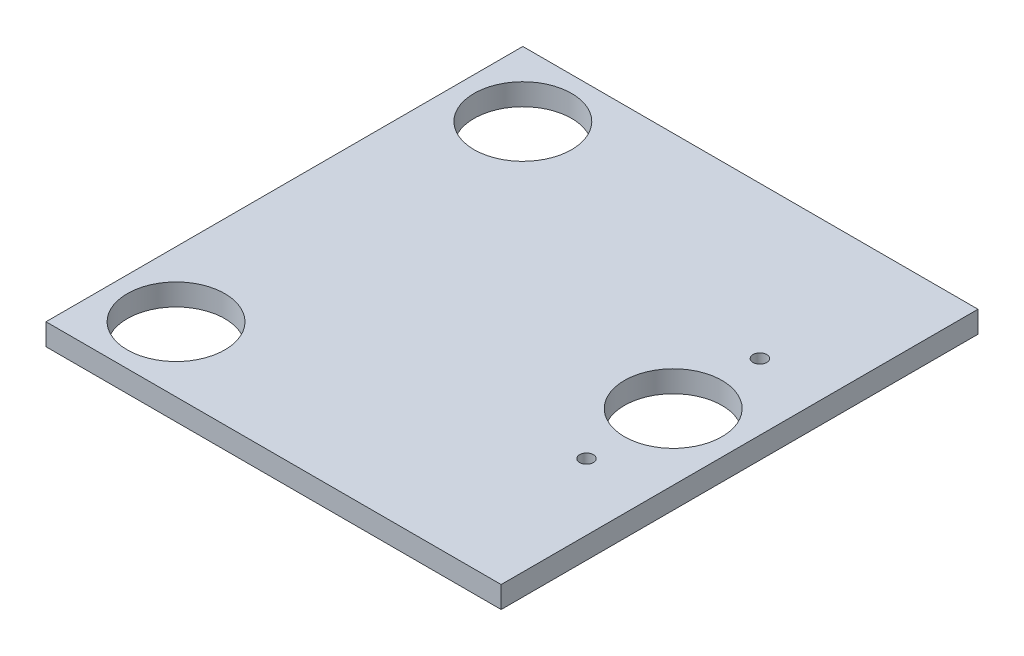
from build123d import *

# Parameters (mm, degrees)
SKETCH1_W           = 133.35
SKETCH1_H           = 139.7
SKETCH1_R           = 14.2875
SKETCH1_R_2         = 2.0193
BOSS_EXTRUDE1_DEPTH = 6.35


with BuildPart() as part:
    # Sketch1 → Boss-Extrude1 (new body)
    with BuildSketch(Plane(origin=(0, 0, 0), x_dir=(1, 0, 0), z_dir=(0, 1, 0))):
        with Locations((66.675, 0)):
            Rectangle(SKETCH1_W, SKETCH1_H)
        with Locations((19.05, 50.8)):
            Circle(SKETCH1_R, mode=Mode.SUBTRACT)
        with Locations((19.05, -50.8)):
            Circle(SKETCH1_R, mode=Mode.SUBTRACT)
        with Locations((113.900712, 0)):
            Circle(SKETCH1_R, mode=Mode.SUBTRACT)
        with Locations((113.900712, 25.4)):
            Circle(SKETCH1_R_2, mode=Mode.SUBTRACT)
        with Locations((113.900712, -25.4)):
            Circle(SKETCH1_R_2, mode=Mode.SUBTRACT)
    extrude(amount=BOSS_EXTRUDE1_DEPTH)


solid = part.part
